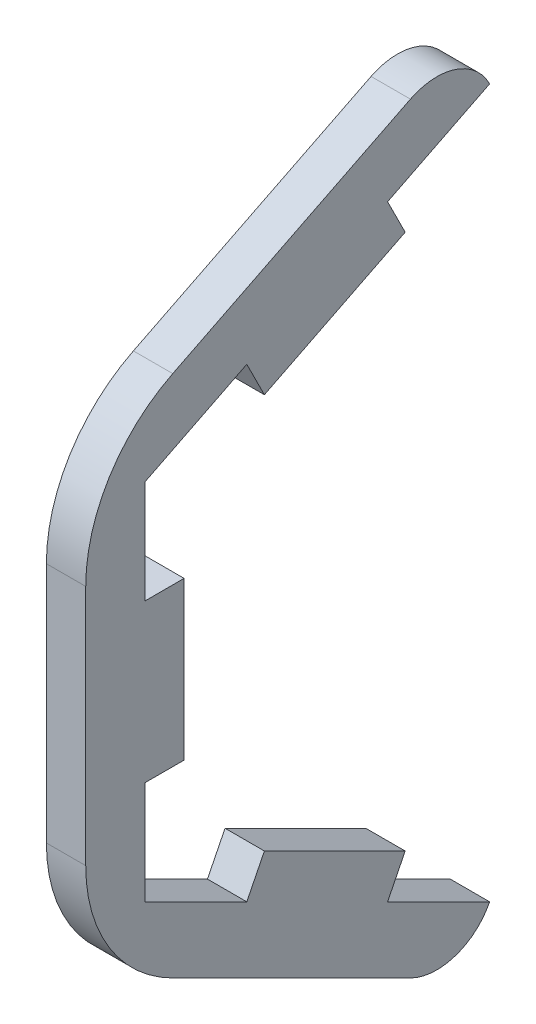
from build123d import *

# Parameters (mm, degrees)
SKETCH1_R             = 7.9375
SKETCH1_R_2           = 11.1125
BOSS_EXTRUDE1_DEPTH   = 12.7
F_8_CLEARANCE_HOLE1_D = 4.4958
SKETCH5_R             = 18.415
CUT_EXTRUDE1_DEPTH    = 218.842023092
SKETCH7_R             = 9.525
CUT_EXTRUDE2_DEPTH    = 218.842023092
CUT_EXTRUDE3_DEPTH    = 218.842023092
BOSS_EXTRUDE2_DEPTH   = 12.7
CUT_EXTRUDE4_DEPTH    = 218.842023092
SKETCH11_W            = 12.7
SKETCH11_H            = 178.054
CUT_EXTRUDE5_DEPTH    = 3.175
BOSS_EXTRUDE3_DEPTH   = 6.35
CUT_EXTRUDE6_DEPTH    = 253.498549798
FILLET1_R             = 12.7
SKETCH16_W            = 6.35
SKETCH16_H            = 25.4
BOSS_EXTRUDE4_DEPTH   = 6.35
CUT_EXTRUDE7_DEPTH    = 253.258895086
FILLET2_R             = 9.525
FILLET3_R             = 25.4


with BuildPart() as part:
    # Sketch1 → Boss-Extrude1 (new body)
    with BuildSketch(Plane(origin=(0, 0, 0), x_dir=(0, 0, -1), z_dir=(1, 0, 0))):
        with BuildLine():
            Line((93.345, 0), (55.245, 50.8))
            Line((55.245, 50.8), (-160.655, 50.8))
            ThreePointArc((-160.655, 50.8), (-211.455, 0), (-160.655, -50.8))
            Line((-160.655, -50.8), (55.245, -50.8))
            Line((55.245, -50.8), (93.345, 0))
        make_face()
        with Locations((-88.9, 0)):
            Circle(SKETCH1_R, mode=Mode.SUBTRACT)
        with Locations((-38.1, 0)):
            Circle(SKETCH1_R, mode=Mode.SUBTRACT)
        with Locations((-160.655, 0)):
            Circle(SKETCH1_R_2, mode=Mode.SUBTRACT)
        Circle(SKETCH1_R, mode=Mode.SUBTRACT)
    extrude(amount=BOSS_EXTRUDE1_DEPTH)

    # #8 Clearance Hole1 (through all)
    with Locations(Plane.ZY):
        with Locations((-17.691104559, 17.691104559), (17.691104559, 17.691104559), (17.691104559, -17.691104559), (-17.691104559, -17.691104559)):
            Hole(F_8_CLEARANCE_HOLE1_D / 2)

    # Sketch5 → Cut-Extrude1 (cut, through all)
    with BuildSketch(Plane.ZY):
        Circle(SKETCH5_R)
    extrude(amount=-CUT_EXTRUDE1_DEPTH, mode=Mode.SUBTRACT)

    # Sketch7 → Cut-Extrude2 (cut, through all)
    with BuildSketch(Plane.ZY):
        with Locations((-55.245, 0)):
            Circle(SKETCH7_R)
    extrude(amount=-CUT_EXTRUDE2_DEPTH, mode=Mode.SUBTRACT)

    # Sketch8 → Cut-Extrude3 (cut, through all)
    with BuildSketch(Plane(origin=(12.7, 0, 0), x_dir=(0, 0, -1), z_dir=(1, 0, 0))):
        Polygon((-160.655, 50.8), (-211.455, 25.4), (-211.455, -25.4), (-160.655, -50.8), (-233.239745749, -50.8), (-233.239745749, 50.8), align=None)
    extrude(amount=-CUT_EXTRUDE3_DEPTH, mode=Mode.SUBTRACT)

    # Sketch9 → Boss-Extrude2 (add)
    with BuildSketch(Plane(origin=(12.7, 0, 0), x_dir=(0, 0, -1), z_dir=(1, 0, 0))):
        Polygon((-160.655, 50.8), (-211.455, 25.4), (-211.455, 0), (-211.455, -25.4), (-160.655, -50.8), (-160.655, -40.64), (-202.749323348, 0), (-160.655, 40.64), align=None)
    extrude(amount=-BOSS_EXTRUDE2_DEPTH)

    # Sketch10 → Cut-Extrude4 (cut, through all)
    with BuildSketch(Plane.ZY):
        Polygon((-79.0575, -19.05), (-79.0575, 19.05), (-93.345, 0), align=None)
    extrude(amount=-CUT_EXTRUDE4_DEPTH, mode=Mode.SUBTRACT)

    # Sketch11 → Cut-Extrude5 (cut)
    with BuildSketch(Plane(origin=(0, 50.8, 0), x_dir=(1, 0, 0), z_dir=(0, 1, 0))):
        with Locations((6.35, -52.705)):
            Rectangle(SKETCH11_W, SKETCH11_H)
    cut_extrude5 = extrude(amount=-CUT_EXTRUDE5_DEPTH, mode=Mode.SUBTRACT)

    # Mirror1: Cut-Extrude5 across plane
    add(cut_extrude5.mirror(Plane.ZX), mode=Mode.SUBTRACT)

    # Sketch13 → Cut-Extrude6 (cut, through all)
    with BuildSketch(Plane(origin=(12.7, 0, 0), x_dir=(0, 0, -1), z_dir=(1, 0, 0))):
        Polygon((-161.254612663, -53.34), (-139.192, -53.34), (-139.192, -50.165), (33.782, -50.165), (33.782, -53.34), (56.515, -53.34), (81.5975, -19.896666667), (81.5975, 19.896666667), (56.515, 53.34), (33.782, 53.34), (33.782, 50.165), (-139.192, 50.165), (-139.192, 53.34), (-161.254612663, 53.34), (-213.995, 26.969806331), (-213.995, -26.969806331), align=None)
    extrude(amount=-CUT_EXTRUDE6_DEPTH, mode=Mode.SUBTRACT)


with BuildPart() as body_2:
    # Sketch12 → Boss-Extrude3 (new body)
    with BuildSketch(Plane(origin=(12.7, 0, 0), x_dir=(0, 0, -1), z_dir=(1, 0, 0))):
        with BuildLine():
            ThreePointArc((-211.89681554, -56.397839854), (-236.855, 0), (-211.89681554, 56.397839854))
            Line((-211.89681554, 56.397839854), (-243.205, 43.989212666))
            Line((-243.205, 43.989212666), (-243.205, -43.989212666))
            Line((-243.205, -43.989212666), (-211.89681554, -56.397839854))
        make_face()
        with BuildLine():
            Line((-217.805, 29.324515829), (-162.154031657, 57.15))
            Line((-162.154031657, 57.15), (-166.916531657, 66.675))
            Line((-166.916531657, 66.675), (-185.966531657, 66.675))
            Line((-185.966531657, 66.675), (-211.89681554, 56.397839854))
            ThreePointArc((-211.89681554, 56.397839854), (-236.855, 0), (-211.89681554, -56.397839854))
            Line((-211.89681554, -56.397839854), (-185.966531657, -66.675))
            Line((-185.966531657, -66.675), (-166.916531657, -66.675))
            Line((-166.916531657, -66.675), (-162.154031657, -57.15))
            Line((-162.154031657, -57.15), (-217.805, -29.324515829))
            Line((-217.805, -29.324515829), (-217.805, 29.324515829))
        make_face()
    extrude(amount=-BOSS_EXTRUDE3_DEPTH)

    # Fillet1
    fillet1_edges = [body_2.edges().sort_by_distance(p)[0] for p in [
        (9.525, -43.989212666, 243.205),
        (9.525, 43.989212666, 243.205),
        (9.525, 66.675, 185.966531657),
        (9.525, 66.675, 166.916531657),
        (9.525, -66.675, 166.916531657),
        (9.525, -66.675, 185.966531657),
    ]]
    fillet(fillet1_edges, radius=FILLET1_R)

    # Sketch16 → Boss-Extrude4 (add)
    with BuildSketch(Plane(origin=(12.7, 0, 0), x_dir=(0, 0, -1), z_dir=(1, 0, 0))):
        with Locations((-214.63, 0)):
            Rectangle(SKETCH16_W, SKETCH16_H)
        Polygon((-178.620290503, -48.916870577), (-175.780484171, -43.237257914), (-198.498934823, -31.878032589), (-201.338741154, -37.557645251), align=None)
        Polygon((-201.338741154, 37.557645251), (-198.498934823, 31.878032589), (-175.780484171, 43.237257914), (-178.620290503, 48.916870577), align=None)
    extrude(amount=-BOSS_EXTRUDE4_DEPTH)

    # Sketch17 → Cut-Extrude7 (cut, through all)
    with BuildSketch(Plane(origin=(12.7, 0, 0), x_dir=(0, 0, -1), z_dir=(1, 0, 0))):
        with BuildLine():
            Line((-174.765563314, 66.675), (-183.541544079, 66.675))
            ThreePointArc((-183.541544079, 66.675), (-185.923497883, 66.44962609), (-188.220911491, 65.781503319))
            Line((-188.220911491, 65.781503319), (-235.184367412, 47.168095163))
            ThreePointArc((-235.184367412, 47.168095163), (-241.010188388, 42.498188858), (-243.205, 35.361591844))
            Line((-243.205, 35.361591844), (-243.205, -35.361591844))
            ThreePointArc((-243.205, -35.361591844), (-241.010188388, -42.498188858), (-235.184367412, -47.168095163))
            Line((-235.184367412, -47.168095163), (-188.220911491, -65.781503319))
            ThreePointArc((-188.220911491, -65.781503319), (-185.923497883, -66.44962609), (-183.541544079, -66.675))
            Line((-183.541544079, -66.675), (-174.765563314, -66.675))
            ThreePointArc((-174.765563314, -66.675), (-171.322248813, -66.199303058), (-168.136883002, -64.80784807))
            Line((-168.136883002, -64.80784807), (-197.079031657, -50.336773743))
            Line((-197.079031657, -50.336773743), (-227.33, -35.211289571))
            Line((-227.33, -35.211289571), (-227.33, -3.175))
            Line((-227.33, -3.175), (-227.33, 3.175))
            Line((-227.33, 3.175), (-227.33, 35.211289571))
            Line((-227.33, 35.211289571), (-197.079031657, 50.336773743))
            Line((-197.079031657, 50.336773743), (-168.136883002, 64.80784807))
            ThreePointArc((-168.136883002, 64.80784807), (-171.322248813, 66.199303058), (-174.765563314, 66.675))
        make_face()
    extrude(amount=-CUT_EXTRUDE7_DEPTH, mode=Mode.SUBTRACT)

    # Fillet2
    # the kernel refuses this fillet: 9.525 mm, written as the material it takes off along each edge
    with BuildSketch(Plane(origin=(36.994694288, -64.80784807, 168.136883002), x_dir=(0, 0.4472135954999565, 0.8944271909999166), z_dir=(-1, 0, 0))) as fillet2_piece_1:
        with BuildLine():
            CenterArc((7.598468847, 9.525), FILLET2_R, 180, 90)
            Line((-1.926531153, 9.525), (-2.879031153, 9.525))
            ThreePointArc((-2.879031153, 9.525), (-2.879031153, 6.724757914), (-0.808010164, -0.504356844))
            Line((-0.808010164, -0.504356844), (0, -0.9525))
            Line((0, -0.9525), (7.598468847, -0.9525))
            Line((7.598468847, -0.9525), (7.598468847, 0))
        make_face()
    extrude(amount=54.939388575, mode=Mode.SUBTRACT)
    with BuildSketch(Plane(origin=(36.994694288, 64.80784807, 168.136883002), x_dir=(0, -0.447213595499958, 0.894427190999916), z_dir=(-1, 0, 0))) as fillet2_piece_2:
        with BuildLine():
            CenterArc((7.598468847, -9.525), FILLET2_R, 90, 90)
            Line((-1.926531153, -9.525), (-2.879031153, -9.525))
            ThreePointArc((-2.879031153, -9.525), (-2.879031153, -6.724757914), (-0.808010164, 0.504356844))
            Line((-0.808010164, 0.504356844), (0, 0.9525))
            Line((0, 0.9525), (7.598468847, 0.9525))
            Line((7.598468847, 0.9525), (7.598468847, 0))
        make_face()
    extrude(amount=54.939388575, mode=Mode.SUBTRACT)

    # Fillet3
    fillet3_edges = [body_2.edges().sort_by_distance(p)[0] for p in [
        (9.525, 35.211289571, 227.33),
        (9.525, -35.211289571, 227.33),
    ]]
    fillet(fillet3_edges, radius=FILLET3_R)


solid = body_2.part
